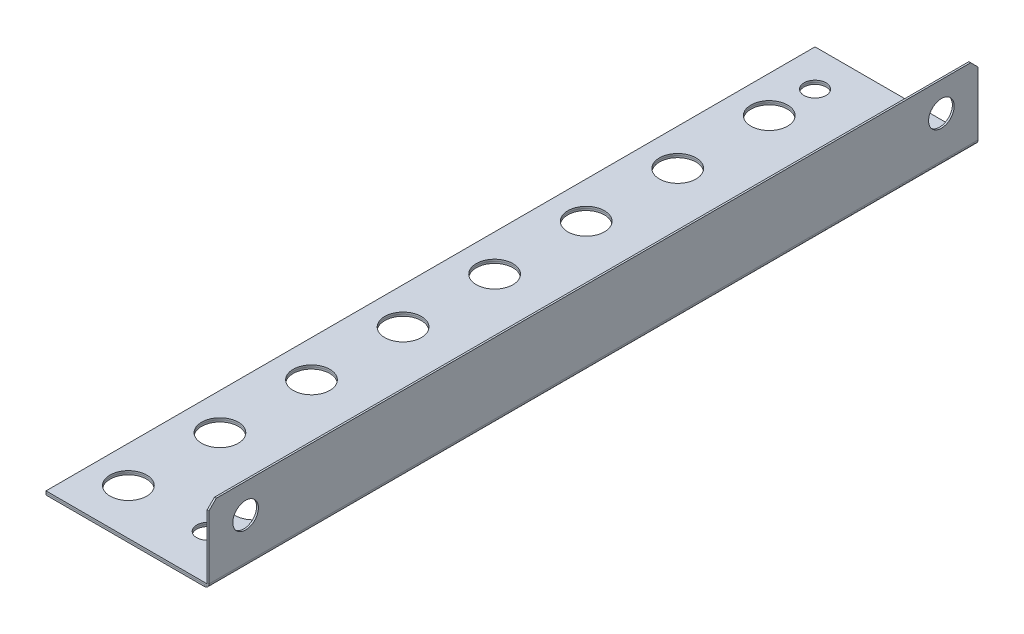
from build123d import *

# Parameters (mm, degrees)
SKETCH1_W                         = 44
SKETCH1_H                         = 210
BOSS_EXTRUDE1_DEPTH               = 0.5
SKETCH1_3_W                       = 44
SKETCH1_3_H                       = 210
BASE_FLANGE1_DEPTH                = 0.5
SKETCH2_3_R                       = 5
CUT_EXTRUDE4_DEPTH                = 10
EDGE_FLANGE1_STRIP_W              = 3.4732
EDGE_FLANGE1_STRIP_H              = 0.5
EDGE_FLANGE1_STRIP_CUT_DEPTH      = 210
EDGE_FLANGE1_DEPTH                = 210
F_7_0_7_DIAMETER_HOLE1_AT_2_COUNT = 2
F_7_0_7_DIAMETER_HOLE1_AT_2_PITCH = 190
BREAK_CORNER1_START               = 12.727922061
BREAK_CORNER1_OUTLINE_W           = 3
BREAK_CORNER1_OUTLINE_H           = 150.220346111
BREAK_CORNER1_DEPTH               = 1.414213563
BREAK_CORNER1_START_2             = -135.764501988
BREAK_CORNER1_2_OUTLINE_W         = 3
BREAK_CORNER1_2_OUTLINE_H         = 1.779653889
BREAK_CORNER1_2_DEPTH             = 2.828427125
SKETCH13_R                        = 3
CUT_EXTRUDE5_DEPTH                = 10


# Read off the part's stored shape, not the designer's step: Break-Corner1
# Sheet-metal steps are written as plain solids
with BuildPart() as part:
    # Sketch1 → Boss-Extrude1 (new body)
    with BuildSketch(Plane(origin=(0, 0, 0), x_dir=(1, 0, 0), z_dir=(0, 1, 0))):
        with Locations((22, -105)):
            Rectangle(SKETCH1_W, SKETCH1_H)
    extrude(amount=BOSS_EXTRUDE1_DEPTH)


with BuildPart() as body_2:
    # Sketch1<3> → Base-Flange1 (new body)
    with BuildSketch(Plane(origin=(0, 0, 0), x_dir=(1, 0, 0), z_dir=(0, 1, 0))):
        with Locations((22, -105)):
            Rectangle(SKETCH1_3_W, SKETCH1_3_H)
    extrude(amount=-BASE_FLANGE1_DEPTH)


with BuildPart() as cut_extrude4_tool:
    # Sketch2<3> → Cut-Extrude4 (new body)
    with BuildSketch(Plane(origin=(0, 0.5, 0), x_dir=(1, 0, 0), z_dir=(0, 1, 0))):
        with Locations(Location((31.650635095, -10, 0), (0, 0, 270))):
            Circle(SKETCH2_3_R)
        with Locations(Location((10, -22.5, 0), (0, 0, 270))):
            Circle(SKETCH2_3_R)
        with Locations(Location((10, -47.5, 0), (0, 0, 270))):
            Circle(SKETCH2_3_R)
        with Locations(Location((31.650635095, -35, 0), (0, 0, 270))):
            Circle(SKETCH2_3_R)
        with Locations(Location((10, -72.5, 0), (0, 0, 270))):
            Circle(SKETCH2_3_R)
        with Locations(Location((31.650635095, -60, 0), (0, 0, 270))):
            Circle(SKETCH2_3_R)
        with Locations(Location((10, -97.5, 0), (0, 0, 270))):
            Circle(SKETCH2_3_R)
        with Locations(Location((31.650635095, -85, 0), (0, 0, 270))):
            Circle(SKETCH2_3_R)
        with Locations(Location((10, -122.5, 0), (0, 0, 270))):
            Circle(SKETCH2_3_R)
        with Locations(Location((31.650635095, -110, 0), (0, 0, 270))):
            Circle(SKETCH2_3_R)
        with Locations(Location((10, -147.5, 0), (0, 0, 270))):
            Circle(SKETCH2_3_R)
        with Locations(Location((31.650635095, -135, 0), (0, 0, 270))):
            Circle(SKETCH2_3_R)
        with Locations(Location((10, -172.5, 0), (0, 0, 270))):
            Circle(SKETCH2_3_R)
        with Locations(Location((31.650635095, -160, 0), (0, 0, 270))):
            Circle(SKETCH2_3_R)
        with Locations(Location((10, -197.5, 0), (0, 0, 270))):
            Circle(SKETCH2_3_R)
        with Locations(Location((31.650635095, -185, 0), (0, 0, 270))):
            Circle(SKETCH2_3_R)
    extrude(amount=-CUT_EXTRUDE4_DEPTH)


with BuildPart() as part_1:
    add(part.part)

    # Cut-Extrude4: cut by cut_extrude4_tool
    add(cut_extrude4_tool.part, mode=Mode.SUBTRACT)


with BuildPart() as body_2_1:
    add(body_2.part)

    # Cut-Extrude4: cut by cut_extrude4_tool
    add(cut_extrude4_tool.part, mode=Mode.SUBTRACT)

    # Edge-Flange1 strip (across the edge) → Edge-Flange1 strip cut (cut)
    with BuildSketch(Plane(origin=(44, 0, 210), x_dir=(-1, 0, 0), z_dir=(0, 0, -1))):
        with Locations((-1, -0.25)):
            Rectangle(EDGE_FLANGE1_STRIP_W, EDGE_FLANGE1_STRIP_H)
    extrude(amount=EDGE_FLANGE1_STRIP_CUT_DEPTH, mode=Mode.SUBTRACT)

    # Edge-Flange1 section (across the edge) → Edge-Flange1 (add)
    with BuildSketch(Plane(origin=(44, 0, 210), x_dir=(-1, 0, 0), z_dir=(0, 0, -1))):
        with BuildLine():
            Line((-0.5, 0.7366), (-0.5, 20))
            Line((-0.5, 20), (0, 20))
            Line((0, 20), (0, 0.7366))
            ThreePointArc((0, 0.7366), (0.215745145, 0.215745145), (0.7366, 0))
            Line((0.7366, 0), (0.7366, -0.5))
            ThreePointArc((0.7366, -0.5), (-0.137808246, -0.137808246), (-0.5, 0.7366))
        make_face()
    extrude(amount=EDGE_FLANGE1_DEPTH)

    # Sketch12 → Ø7.0 (7) Diameter Hole1 (revolve, cut)
    with BuildSketch(Plane(origin=(44.5, 12, 10), x_dir=(0, 0, -1), z_dir=(0, 1, 0))):
        Polygon((0, 0), (0, 17.103012167), (3.5, 15), (3.5, 0), align=None)
    f_7_0_7_diameter_hole1 = revolve(axis=Axis((50.85, 12, 10), (-1, 0, 0)), mode=Mode.SUBTRACT)

    # Ø7.0 (7) Diameter Hole1 at 2: Ø7.0 (7) Diameter Hole1 ×2
    with Locations(*[(0, 0, i * F_7_0_7_DIAMETER_HOLE1_AT_2_PITCH) for i in range(1, F_7_0_7_DIAMETER_HOLE1_AT_2_COUNT)]):
        add(f_7_0_7_diameter_hole1, mode=Mode.SUBTRACT)

    # Break-Corner1 outline → Break-Corner1 (cut)
    with BuildSketch(Plane(origin=(0, 0, 0), x_dir=(1, 0, 0), z_dir=(0, 0.707106781186549, -0.707106781186546)).offset(BREAK_CORNER1_START)):
        with Locations((44.5, -86.110173055)):
            Rectangle(BREAK_CORNER1_OUTLINE_W, BREAK_CORNER1_OUTLINE_H)
    extrude(amount=BREAK_CORNER1_DEPTH, mode=Mode.SUBTRACT)

    # Break-Corner1 2 outline → Break-Corner1 2 (cut)
    with BuildSketch(Plane(origin=(0, 0, 0), x_dir=(1, 0, 0), z_dir=(0, 0.707106781186549, -0.707106781186546)).offset(BREAK_CORNER1_START_2)):
        with Locations((44.5, -162.110173056)):
            Rectangle(BREAK_CORNER1_2_OUTLINE_W, BREAK_CORNER1_2_OUTLINE_H)
    extrude(amount=BREAK_CORNER1_2_DEPTH, mode=Mode.SUBTRACT)


with BuildPart() as cut_extrude5_tool:
    # Sketch13 → Cut-Extrude5 (new body)
    with BuildSketch(Plane.XZ.offset(0.5)):
        with Locations(Location((31.650635095, 197.5, 0), (0, 0, 270))):
            Circle(SKETCH13_R)
        with Locations(Location((10, 10, 0), (0, 0, 270))):
            Circle(SKETCH13_R)
    extrude(amount=-CUT_EXTRUDE5_DEPTH)


with BuildPart() as part_2:
    add(part_1.part)

    # Cut-Extrude5: cut by cut_extrude5_tool
    add(cut_extrude5_tool.part, mode=Mode.SUBTRACT)


with BuildPart() as body_2_2:
    add(body_2_1.part)

    # Cut-Extrude5: cut by cut_extrude5_tool
    add(cut_extrude5_tool.part, mode=Mode.SUBTRACT)


solid = Compound([part_2.part, body_2_2.part])
